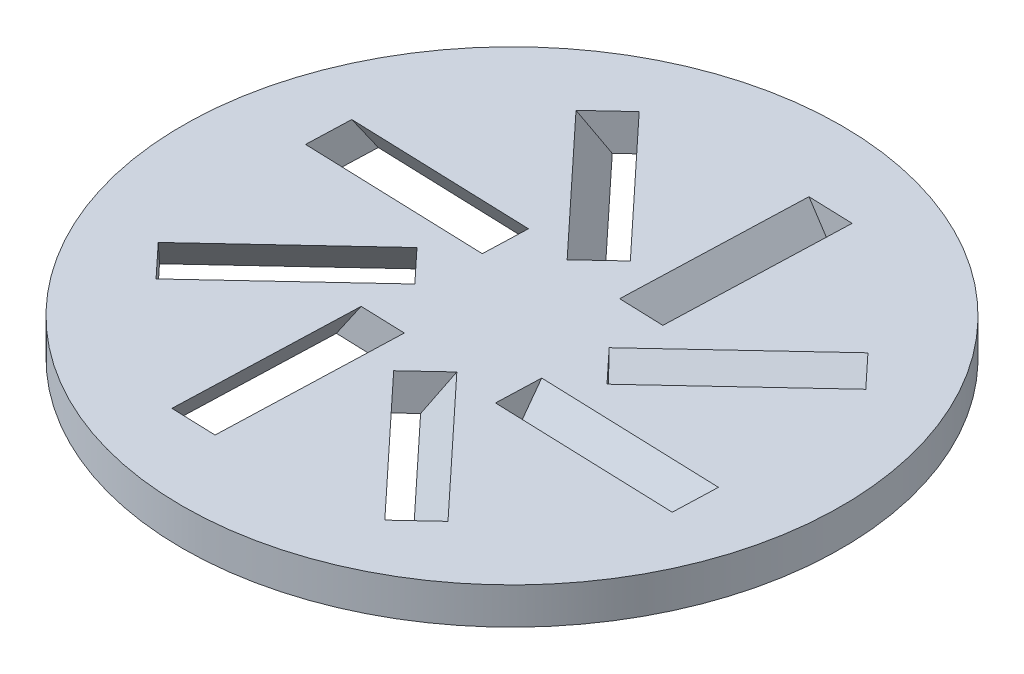
from build123d import *

# Parameters (mm, degrees)
SKETCH1_R           = 45
BOSS_EXTRUDE1_DEPTH = 5
CUT_EXTRUDE1_DEPTH  = 5
CIRPATTERN3_COUNT   = 8


with BuildPart() as part:
    # Sketch1 → Boss-Extrude1 (new body)
    with BuildSketch(Plane(origin=(0, 0, 0), x_dir=(1, 0, 0), z_dir=(0, 1, 0))):
        Circle(SKETCH1_R)
    extrude(amount=BOSS_EXTRUDE1_DEPTH)

    # Sketch8 → Cut-Extrude1 (cut)
    with BuildSketch(Plane(origin=(3.893036241, 3.994181194, 4.169304611), x_dir=(-0.8013831328270826, 0.5590517167893936, 0.21271166487779272), z_dir=(0.5590517167893935, 0.5735764363510444, 0.5987246859932103))):
        Polygon((-0.726878064, -13.227593353), (-19.374986634, 6.743873708), (-37.647683692, -10.318029533), (-18.999575123, -30.289496595), align=None)
    cut_extrude1 = extrude(amount=CUT_EXTRUDE1_DEPTH, mode=Mode.SUBTRACT)

    # CirPattern3: Cut-Extrude1 ×8 about axis
    cirpattern3_axis = Axis((0, 5, 0), (0, 1, 0))
    for i in range(1, CIRPATTERN3_COUNT):
        add(cut_extrude1.rotate(cirpattern3_axis, i * 360 / CIRPATTERN3_COUNT), mode=Mode.SUBTRACT)


solid = part.part
